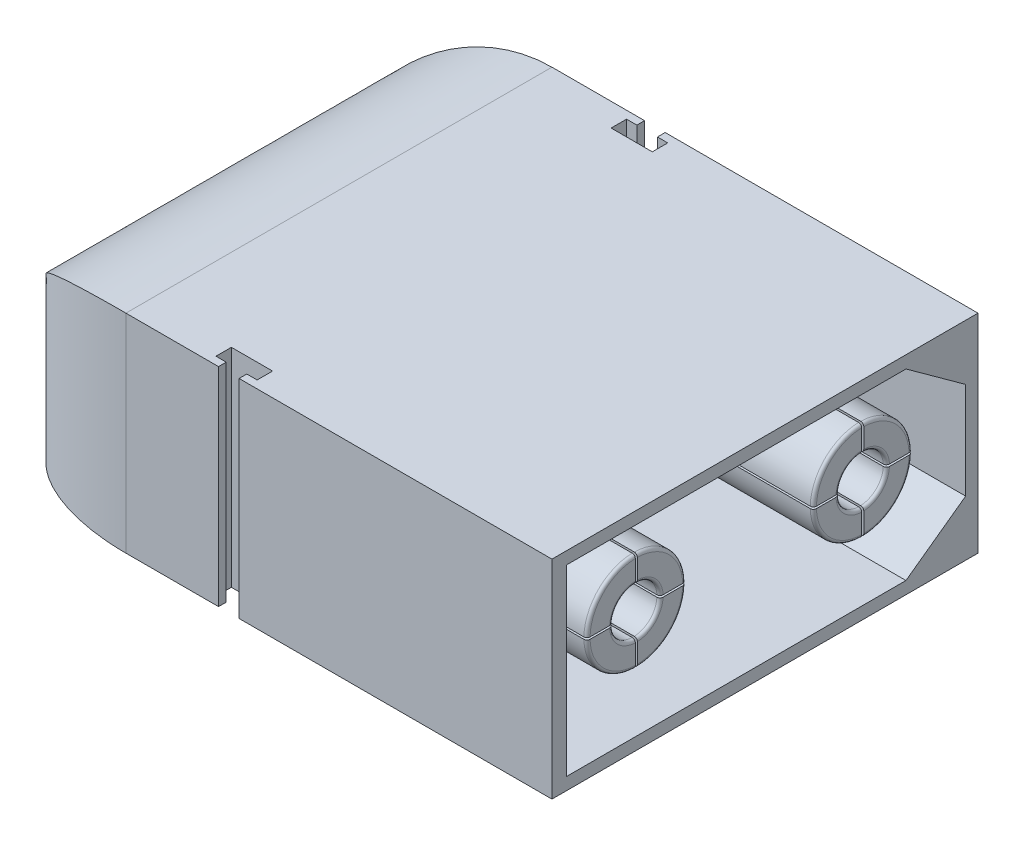
from build123d import *

# Parameters (mm, degrees)
SKETCH1_W           = 6.5
SKETCH1_H           = 20.7
BOSS_EXTRUDE1_DEPTH = 10.1
FILLET1_SIZE        = 4
FILLET1_SIZE_2      = 6.5
FILLET2_SIZE        = 3.5
FILLET2_SIZE_2      = 6.5
CUT_EXTRUDE1_DEPTH  = 12.8
BOSS_EXTRUDE2_DEPTH = 12
FILLET3_R           = 0.15
SKETCH4_R           = 1.75
BOSS_EXTRUDE3_DEPTH = 2.7
FILLET4_R           = 0.15


with BuildPart() as part:
    # Sketch1 → Boss-Extrude1 (new body)
    with BuildSketch(Plane(origin=(0, 0, 0), x_dir=(1, 0, 0), z_dir=(0, 1, 0))):
        Polygon((-2.6, 10.35), (-7.1, 10.35), (-7.1, -10.35), (-2.6, -10.35), (-2.6, -9.975), (-3.1, -9.975), (-3.1, -9.225), (-1.1, -9.225), (-1.1, -9.975), (-1.6, -9.975), (-1.6, -10.35), (13.6, -10.35), (13.6, 10.35), (-1.6, 10.35), (-1.6, 9.975), (-1.1, 9.975), (-1.1, 9.225), (-3.1, 9.225), (-3.1, 9.975), (-2.6, 9.975), align=None)
        with Locations((-10.35, 0)):
            Rectangle(SKETCH1_W, SKETCH1_H)
    extrude(amount=BOSS_EXTRUDE1_DEPTH)

    # Fillet1
    # a fillet whose section is not a circle: 6.5, 4 mm, written as the material it takes off along each edge
    with BuildSketch(Plane(origin=(-13.6, 10.1, -26.6), x_dir=(0, -1, 0), z_dir=(0, 0, 1))) as fillet1_piece_1:
        with BuildLine():
            Bezier((FILLET1_SIZE, 0), (0, 0), (0, FILLET1_SIZE_2), weights=[1, 0.707106781, 1])
            Line((0, FILLET1_SIZE_2), (0, 0))
            Line((0, 0), (FILLET1_SIZE, 0))
        make_face()
    extrude(amount=53.2, mode=Mode.SUBTRACT)

    # Fillet2
    # a fillet whose section is not a circle: 6.5, 3.5 mm, written as the material it takes off along each edge
    with BuildSketch(Plane(origin=(-13.6, -16.25, 10.35), x_dir=(0, 0, -1), z_dir=(0, 1, 0))) as fillet2_piece_1:
        with BuildLine():
            Bezier((FILLET2_SIZE, 0), (0, 0), (0, -FILLET2_SIZE_2), weights=[1, 0.707106781, 1])
            Line((0, -FILLET2_SIZE_2), (0, 0))
            Line((0, 0), (FILLET2_SIZE, 0))
        make_face()
    extrude(amount=38.6, mode=Mode.SUBTRACT)
    with BuildSketch(Plane(origin=(-13.6, -16.25, -10.35), x_dir=(1, 0, 0), z_dir=(0, 1, 0))) as fillet2_piece_2:
        with BuildLine():
            Bezier((FILLET2_SIZE_2, 0), (0, 0), (0, -FILLET2_SIZE), weights=[1, 0.707106781, 1])
            Line((0, -FILLET2_SIZE), (0, 0))
            Line((0, 0), (FILLET2_SIZE_2, 0))
        make_face()
    extrude(amount=38.6, mode=Mode.SUBTRACT)

    # Sketch2 → Cut-Extrude1 (cut)
    with BuildSketch(Plane(origin=(13.6, 0, 0), x_dir=(0, 0, -1), z_dir=(1, 0, 0))):
        Polygon((-9.65, 9.5), (-9.65, 0.6), (6.85, 0.6), (9.75, 2.7), (9.75, 7.4), (6.85, 9.5), align=None)
    extrude(amount=-CUT_EXTRUDE1_DEPTH, mode=Mode.SUBTRACT)

    # Sketch3 → Boss-Extrude2 (add)
    with BuildSketch(Plane(origin=(0.8, 0, 0), x_dir=(0, 0, -1), z_dir=(1, 0, 0))):
        with BuildLine():
            Line((5.5, 7.44947911), (5.5, 6.198912529))
            ThreePointArc((5.5, 6.198912529), (4.736827202, 5.863172798), (4.401087471, 5.1))
            Line((4.401087471, 5.1), (3.15052089, 5.1))
            ThreePointArc((3.15052089, 5.1), (3.852943725, 6.747056275), (5.5, 7.44947911))
        make_face()
        with BuildLine():
            Line((5.6, 7.44947911), (5.6, 6.198912529))
            ThreePointArc((5.6, 6.198912529), (6.363172798, 5.863172798), (6.698912529, 5.1))
            Line((6.698912529, 5.1), (7.94947911, 5.1))
            ThreePointArc((7.94947911, 5.1), (7.247056275, 6.747056275), (5.6, 7.44947911))
        make_face()
        with BuildLine():
            Line((-5.5, 7.44947911), (-5.5, 6.198912529))
            ThreePointArc((-5.5, 6.198912529), (-6.263172798, 5.863172798), (-6.598912529, 5.1))
            Line((-6.598912529, 5.1), (-7.84947911, 5.1))
            ThreePointArc((-7.84947911, 5.1), (-7.147056275, 6.747056275), (-5.5, 7.44947911))
        make_face()
        with BuildLine():
            Line((-5.4, 7.44947911), (-5.4, 6.198912529))
            ThreePointArc((-5.4, 6.198912529), (-4.636827202, 5.863172798), (-4.301087471, 5.1))
            Line((-4.301087471, 5.1), (-3.05052089, 5.1))
            ThreePointArc((-3.05052089, 5.1), (-3.752943725, 6.747056275), (-5.4, 7.44947911))
        make_face()
        with BuildLine():
            Line((-3.05052089, 5), (-4.301087471, 5))
            ThreePointArc((-4.301087471, 5), (-4.636827202, 4.236827202), (-5.4, 3.901087471))
            Line((-5.4, 3.901087471), (-5.4, 2.65052089))
            ThreePointArc((-5.4, 2.65052089), (-3.752943725, 3.352943725), (-3.05052089, 5))
        make_face()
        with BuildLine():
            Line((-5.5, 2.65052089), (-5.5, 3.901087471))
            ThreePointArc((-5.5, 3.901087471), (-6.263172798, 4.236827202), (-6.598912529, 5))
            Line((-6.598912529, 5), (-7.84947911, 5))
            ThreePointArc((-7.84947911, 5), (-7.147056275, 3.352943725), (-5.5, 2.65052089))
        make_face()
        with BuildLine():
            Line((7.94947911, 5), (6.698912529, 5))
            ThreePointArc((6.698912529, 5), (6.363172798, 4.236827202), (5.6, 3.901087471))
            Line((5.6, 3.901087471), (5.6, 2.65052089))
            ThreePointArc((5.6, 2.65052089), (7.247056275, 3.352943725), (7.94947911, 5))
        make_face()
        with BuildLine():
            Line((5.5, 2.65052089), (5.5, 3.901087471))
            ThreePointArc((5.5, 3.901087471), (4.736827202, 4.236827202), (4.401087471, 5))
            Line((4.401087471, 5), (3.15052089, 5))
            ThreePointArc((3.15052089, 5), (3.852943725, 3.352943725), (5.5, 2.65052089))
        make_face()
    extrude(amount=BOSS_EXTRUDE2_DEPTH)

    # Fillet3
    fillet3_edges = [part.edges().sort_by_distance(p)[0] for p in [
        (12.8, 3.352943725, 7.147056275),
        (12.8, 4.236827202, 6.263172798),
        (12.8, 3.352943725, -3.852943725),
        (12.8, 4.236827202, -4.736827202),
        (12.8, 5.863172798, -6.363172798),
        (12.8, 6.747056275, -7.247056275),
        (12.8, 4.236827202, -6.363172798),
        (12.8, 3.352943725, -7.247056275),
        (12.8, 5.863172798, 4.636827202),
        (12.8, 6.747056275, 3.752943725),
        (12.8, 4.236827202, 4.636827202),
        (12.8, 3.352943725, 3.752943725),
        (12.8, 6.747056275, 7.147056275),
        (12.8, 5.863172798, 6.263172798),
        (12.8, 6.747056275, -3.852943725),
        (12.8, 5.863172798, -4.736827202),
    ]]
    fillet(fillet3_edges, radius=FILLET3_R)

    # Sketch4 → Boss-Extrude3 (add)
    with BuildSketch(Plane.XZ):
        with Locations(Location((-11.1, -5.65, 0), (0, 0, 90))):
            Circle(SKETCH4_R)
        with Locations(Location((-11.1, 5.65, 0), (0, 0, 90))):
            Circle(SKETCH4_R)
    extrude(amount=BOSS_EXTRUDE3_DEPTH)

    # Fillet4
    fillet4_edges = [part.edges().sort_by_distance(p)[0] for p in [
        (-11.1, -2.7, -7.4),
        (-11.1, -2.7, 3.9),
    ]]
    fillet(fillet4_edges, radius=FILLET4_R)


solid = part.part
